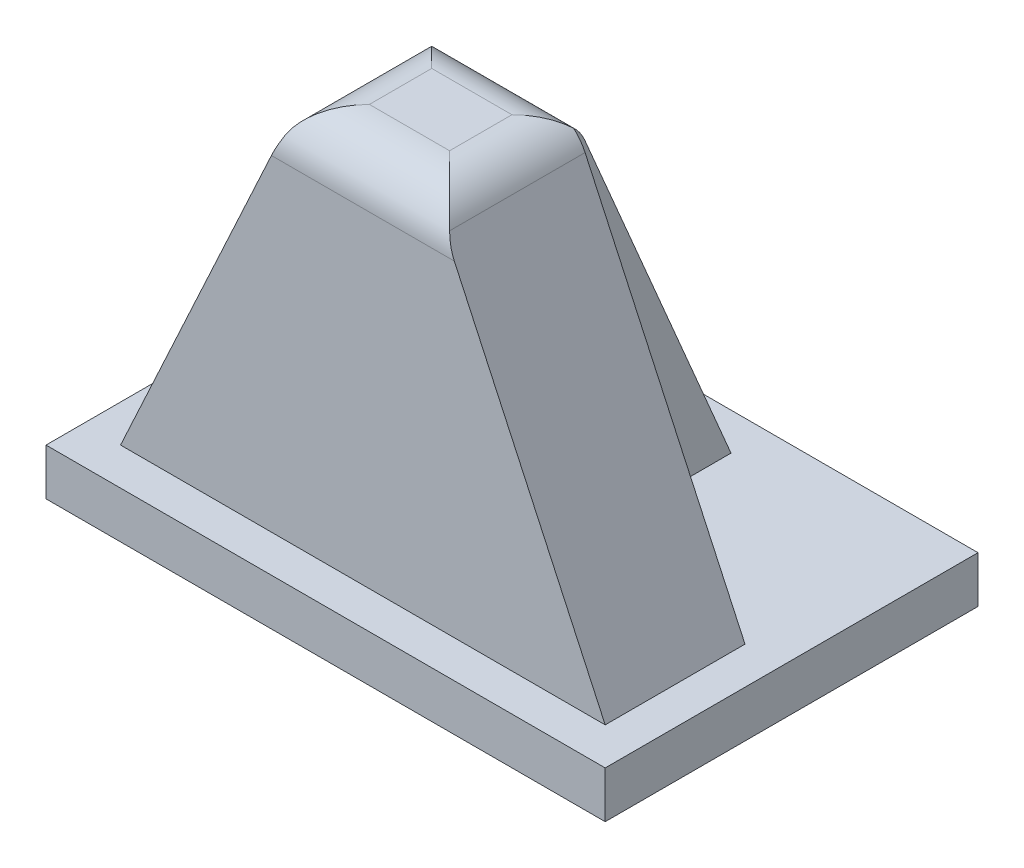
from build123d import *

# Parameters (mm, degrees)
SKETCH1_W               = 38.1
SKETCH1_H               = 25.4
SKETCH1_W_2             = 33.02
SKETCH1_H_2             = 20.32
SKETCH1_W_3             = 11.7475
SKETCH1_H_3             = 10.795
SKETCH1_W_4             = 9.525
BOSS_EXTRUDE1_DEPTH     = 3.175
SKETCH1_3_W             = 9.525
SKETCH1_3_H             = 10.795
BOSS_EXTRUDE2_DEPTH     = 25.4
CUT_EXTRUDE1_DEPTH      = 40.123421374
CUT_EXTRUDE2_DEPTH      = 38.060560658
CUT_EXTRUDE2_DEPTH_BACK = 38.060560658
FILLET7_R               = 3.175


with BuildPart() as part:
    # Sketch1 → Boss-Extrude1 (new body)
    # profile 1 of 5: a face of its own
    with BuildSketch(Plane(origin=(0, 0, 0), x_dir=(1, 0, 0), z_dir=(0, 1, 0))):
        Rectangle(SKETCH1_W, SKETCH1_H)
        Rectangle(SKETCH1_W_2, SKETCH1_H_2, mode=Mode.SUBTRACT)
    # profile 2 of 5: a face of its own
    with BuildSketch(Plane(origin=(0, 0, 0), x_dir=(1, 0, 0), z_dir=(0, 1, 0))):
        with Locations((-10.63625, 4.7625)):
            Rectangle(SKETCH1_W_3, SKETCH1_H_3)
    # profile 3 of 5: a face of its own
    with BuildSketch(Plane(origin=(0, 0, 0), x_dir=(1, 0, 0), z_dir=(0, 1, 0))):
        with Locations((10.63625, 4.7625)):
            Rectangle(SKETCH1_W_3, SKETCH1_H_3)
    # profile 4 of 5: a face of its own
    with BuildSketch(Plane(origin=(0, 0, 0), x_dir=(1, 0, 0), z_dir=(0, 1, 0))):
        with Locations((0, 4.7625)):
            Rectangle(SKETCH1_W_4, SKETCH1_H_3)
    # profile 5 of 5: a face of its own
    with BuildSketch(Plane(origin=(0, 0, 0), x_dir=(1, 0, 0), z_dir=(0, 1, 0))):
        Polygon((-4.7625, -0.635), (-16.51, -0.635), (-16.51, -10.16), (16.51, -10.16), (16.51, -0.635), (4.7625, -0.635), align=None)
    extrude(amount=-BOSS_EXTRUDE1_DEPTH)

    # Sketch1<3> → Boss-Extrude2 (add)
    with BuildSketch(Plane(origin=(0, 0, 0), x_dir=(1, 0, 0), z_dir=(0, 1, 0))):
        with Locations((0, 4.7625)):
            Rectangle(SKETCH1_3_W, SKETCH1_3_H)
        Polygon((-4.7625, -0.635), (-16.51, -0.635), (-16.51, -10.16), (16.51, -10.16), (16.51, -0.635), (4.7625, -0.635), align=None)
    extrude(amount=BOSS_EXTRUDE2_DEPTH)

    # Sketch2 → Cut-Extrude1 (cut, through all)
    with BuildSketch(Plane.XY.offset(10.16)):
        Polygon((-16.51, 25.4), (-16.51, 0), (-4.7625, 25.4), align=None)
        Polygon((4.7625, 25.4), (16.51, 0), (16.51, 25.4), align=None)
    extrude(amount=-CUT_EXTRUDE1_DEPTH, mode=Mode.SUBTRACT)

    # Sketch3 → Cut-Extrude2 (cut, two sides: drawn at the far end of the back side and taken through both)
    with BuildSketch(Plane(origin=(4.7625, 0, 0), x_dir=(0, 0, -1), z_dir=(1, 0, 0)).offset(-CUT_EXTRUDE2_DEPTH_BACK)):
        Polygon((-0.635, 25.4), (10.16, 0), (10.16, 25.4), align=None)
    extrude(amount=CUT_EXTRUDE2_DEPTH + CUT_EXTRUDE2_DEPTH_BACK, mode=Mode.SUBTRACT)

    # Fillet7
    # the kernel refuses this fillet: 3.175 mm, written as the material it takes off along each edge
    with BuildSketch(Plane(origin=(-12.7, 25.4, 10.16), x_dir=(0, 0, -1), z_dir=(1, 0, 0))) as fillet7_piece_1:
        with BuildLine():
            CenterArc((FILLET7_R, -FILLET7_R), FILLET7_R, 90, 90)
            Line((0, -FILLET7_R), (0, 0))
            Line((0, 0), (FILLET7_R, 0))
        make_face()
    extrude(amount=25.4, mode=Mode.SUBTRACT)
    with BuildSketch(Plane(origin=(-4.7625, 25.4, 15.234238466), x_dir=(1, 0, 0), z_dir=(0, 0, -1)), Plane(origin=(4.7625, 25.4, 15.234238466), x_dir=(0.4197775063604339, -0.9076270407793146, 0), z_dir=(0, 0, -1))) as fillet7_piece_2:
        with BuildLine():
            CenterArc((FILLET7_R * 0.639274137471, FILLET7_R), FILLET7_R, 204.820541335, 65.179458665)
            Line((-FILLET7_R * 0.268352903308, FILLET7_R * 0.58022249364), (0, 0))
            Line((0, 0), (FILLET7_R * 0.639274137471, 0))
        make_face()
    extrude(amount=19.673476932, mode=Mode.SUBTRACT)
    with BuildSketch(Plane(origin=(10.013677669, 25.4, 0.635), x_dir=(0, 0, 1), z_dir=(-1, 0, 0))) as fillet7_piece_3:
        with BuildLine():
            CenterArc((FILLET7_R * 0.661565690605, -FILLET7_R), FILLET7_R, 90, 66.974507991)
            Line((-FILLET7_R * 0.258765227853, -FILLET7_R * 0.608859359655), (0, 0))
            Line((0, 0), (FILLET7_R * 0.661565690605, 0))
        make_face()
    extrude(amount=20.027355338, mode=Mode.SUBTRACT)


solid = part.part
